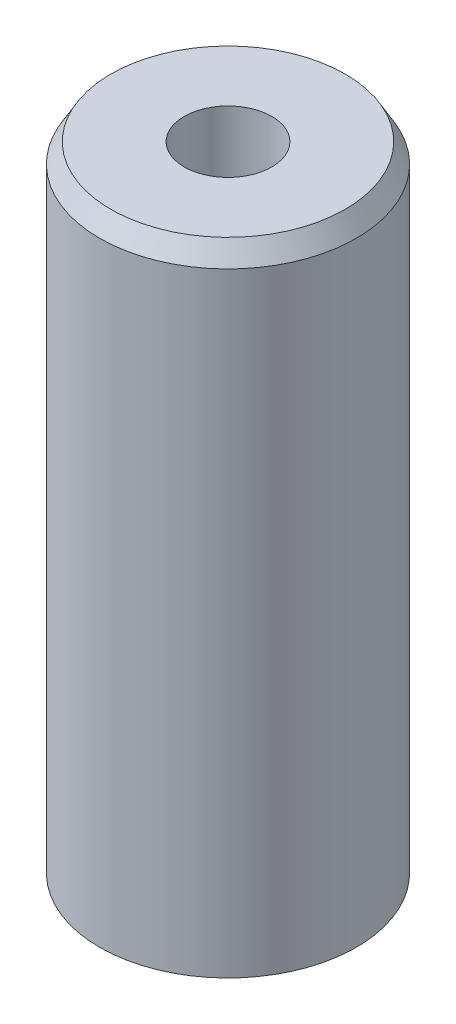
from build123d import *
from OCP.BRepFilletAPI import BRepFilletAPI_MakeChamfer

# Parameters (mm, degrees)
SKETCH1_R           = 35
BOSS_EXTRUDE1_DEPTH = 175.723743771
SKETCH2_R           = 11.939584418
CUT_EXTRUDE1_DEPTH  = 183.56186383
CHAMFER1_SIZE       = 5.296407663
CHAMFER1_SIZE2      = 3.05788239


with BuildPart() as part:
    # Sketch1 → Boss-Extrude1 (new body)
    with BuildSketch(Plane(origin=(0, 0, 0), x_dir=(1, 0, 0), z_dir=(0, 1, 0))):
        Circle(SKETCH1_R)
    extrude(amount=BOSS_EXTRUDE1_DEPTH)

    # Sketch2 → Cut-Extrude1 (cut, through all)
    with BuildSketch(Plane(origin=(0, 0, 0), x_dir=(1, 0, 0), z_dir=(0, 1, 0))):
        Circle(SKETCH2_R)
    extrude(amount=CUT_EXTRUDE1_DEPTH, mode=Mode.SUBTRACT)

    # Chamfer1: one chamfer whose edges measure the first distance from different faces: ONE call of the kernel's chamfer builder (chamfer() names one face for all edges)
    chamfer1_edges_1 = [part.edges().sort_by_distance(p)[0] for p in [
        (-35, 175.723743771, 0),
    ]]
    chamfer1_side_1 = [part.faces().sort_by_distance(p)[0] for p in [
        (-35, 87.861871886, 0),
    ]]
    chamfer1_edges_2 = [part.edges().sort_by_distance(p)[0] for p in [
        (-35, 0, 0),
    ]]
    chamfer1_side_2 = [part.faces().sort_by_distance(p)[0] for p in [
        (-34.010050506, 0, 0),
    ]]
    chamfer1 = BRepFilletAPI_MakeChamfer(part.part.solid().wrapped)
    for e in chamfer1_edges_1:
        chamfer1.Add(CHAMFER1_SIZE, CHAMFER1_SIZE2, e.wrapped, chamfer1_side_1[0].wrapped)  # the first distance lies on this face
    for e in chamfer1_edges_2:
        chamfer1.Add(CHAMFER1_SIZE, CHAMFER1_SIZE2, e.wrapped, chamfer1_side_2[0].wrapped)  # the first distance lies on this face
    add(Compound.cast(chamfer1.Shape()), mode=Mode.REPLACE)


solid = part.part
